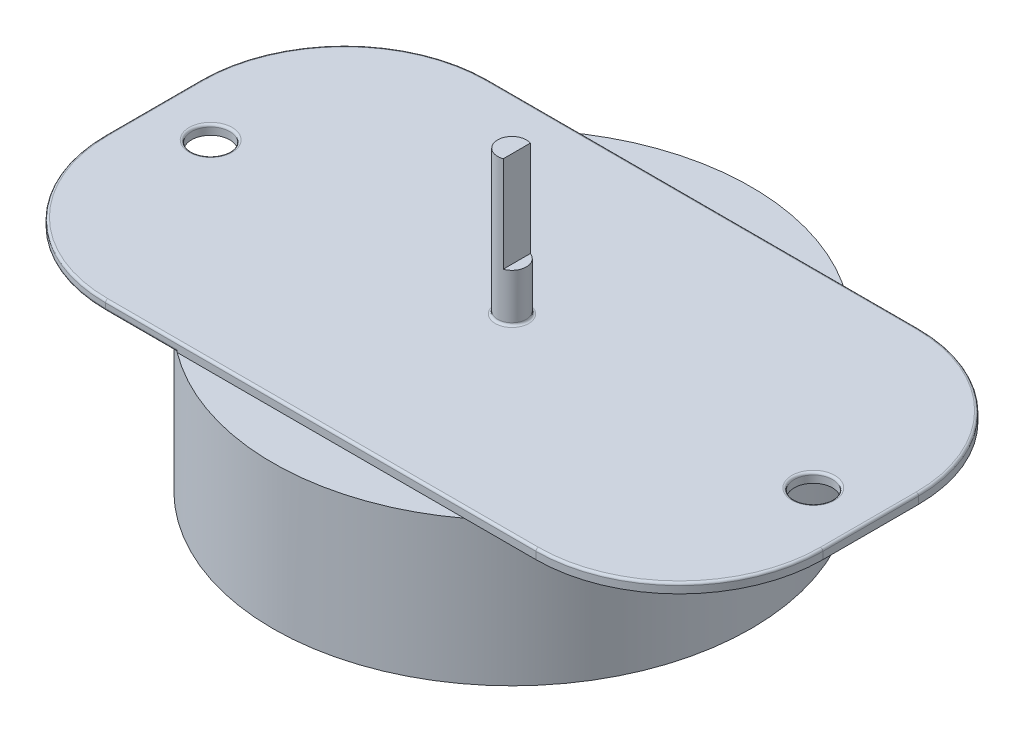
from build123d import *

# Parameters (mm, degrees)
ESBO_O1_R                = 50
RESSALTO_EXTRUS_O1_DEPTH = 30
RESSALTO_EXTRUS_O2_DEPTH = 2
ESBO_O3_R                = 3
RESSALTO_EXTRUS_O3_DEPTH = 30
ESBO_O4_W                = 2.913486889
ESBO_O4_H                = 6.765215319
CORTE_EXTRUS_O1_DEPTH    = 20
CORTE_EXTRUS_O2_REACH    = 97.65
ESBO_O6_R                = 4
FILETE2_R                = 0.5


with BuildPart() as part:
    # Esboço1 → Ressalto-extrusão1 (new body)
    with BuildSketch(Plane(origin=(0, 0, 0), x_dir=(1, 0, 0), z_dir=(0, 1, 0))):
        with Locations(Location((0, 0, 0), (0, 0, 270))):
            Circle(ESBO_O1_R)
    extrude(amount=RESSALTO_EXTRUS_O1_DEPTH)

    # Esboço2 → Ressalto-extrusão2 (add)
    with BuildSketch(Plane(origin=(0, 30, 0), x_dir=(1, 0, 0), z_dir=(0, 1, 0))):
        with BuildLine():
            Line((-45, -40), (45, -40))
            ThreePointArc((45, -40), (66.213203436, -31.213203436), (75, -10))
            Line((75, -10), (75, 10))
            ThreePointArc((75, 10), (66.213203436, 31.213203436), (45, 40))
            Line((45, 40), (-45, 40))
            ThreePointArc((-45, 40), (-66.213203436, 31.213203436), (-75, 10))
            Line((-75, 10), (-75, -10))
            ThreePointArc((-75, -10), (-66.213203436, -31.213203436), (-45, -40))
        make_face()
    extrude(amount=RESSALTO_EXTRUS_O2_DEPTH)

    # Esboço3 → Ressalto-extrusão3 (add)
    with BuildSketch(Plane(origin=(0, 32, 0), x_dir=(1, 0, 0), z_dir=(0, 1, 0))):
        with Locations(Location((0, 0, 0), (0, 0, 90))):
            Circle(ESBO_O3_R)
    extrude(amount=RESSALTO_EXTRUS_O3_DEPTH)

    # Esboço4 → Corte-extrusão1 (cut)
    with BuildSketch(Plane(origin=(0, 62, 0), x_dir=(1, 0, 0), z_dir=(0, 1, 0))):
        with Locations((2.456743444, -0.010763652)):
            Rectangle(ESBO_O4_W, ESBO_O4_H)
    extrude(amount=-CORTE_EXTRUS_O1_DEPTH, mode=Mode.SUBTRACT)

    # Esboço6 → Corte-extrusão2 (cut, up to next)
    with BuildSketch(Plane(origin=(0, 32, 0), x_dir=(1, 0, 0), z_dir=(0, 1, 0)), mode=Mode.PRIVATE) as corte_extrus_o2_sk1:
        with Locations(Location((-63, 0, 0), (0, 0, 270))):
            Circle(ESBO_O6_R)
    corte_extrus_o2_tool1 = extrude(corte_extrus_o2_sk1.sketch, amount=-CORTE_EXTRUS_O2_REACH, mode=Mode.PRIVATE) & part.part
    # Esboço6 → Corte-extrusão2 (cut, up to next)
    with BuildSketch(Plane(origin=(0, 32, 0), x_dir=(1, 0, 0), z_dir=(0, 1, 0)), mode=Mode.PRIVATE) as corte_extrus_o2_sk2:
        with Locations(Location((63, 0, 0), (0, 0, 90))):
            Circle(ESBO_O6_R)
    corte_extrus_o2_tool2 = extrude(corte_extrus_o2_sk2.sketch, amount=-CORTE_EXTRUS_O2_REACH, mode=Mode.PRIVATE) & part.part
    add(corte_extrus_o2_tool1.solids().sort_by_distance((-63, 32, 0))[0], mode=Mode.SUBTRACT)
    add(corte_extrus_o2_tool2.solids().sort_by_distance((63, 32, 0))[0], mode=Mode.SUBTRACT)

    # Filete2
    # the kernel refuses this fillet: 0.5 mm, written as the material it adds along each edge
    with BuildSketch(Plane(origin=(0, 32, 0), x_dir=(0, 0, -1), z_dir=(1, 0, 0))) as filete2_piece_1:
        with BuildLine():
            CenterArc((3 + FILETE2_R, FILETE2_R), FILETE2_R, 180, 90)
            Line((3, FILETE2_R), (3, 0))
            Line((3, 0), (3 + FILETE2_R, 0))
        make_face()
    revolve(axis=Axis((0, 32, 0), (0, 1, 0)))
    # the kernel refuses this fillet: 0.5 mm, written as the material it takes off along each edge
    with BuildSketch(Plane(origin=(-45, 30, 40), x_dir=(0, 0, -1), z_dir=(1, 0, 0))) as filete2_2_piece_1_section:
        with BuildLine():
            CenterArc((FILETE2_R, FILETE2_R), FILETE2_R, 180, 90)
            Line((0, FILETE2_R), (0, 0))
            Line((0, 0), (FILETE2_R, 0))
        make_face()
    filete2_2_piece_1 = extrude(amount=16.25, mode=Mode.PRIVATE)
    filete2_2_piece_1 = filete2_2_piece_1 - Plane(origin=(0, 30.083724815, 0), x_dir=(0, 0, 1), z_dir=(0, -1, 0)) * Cylinder(50, 35, mode=Mode.PRIVATE)
    add(filete2_2_piece_1, mode=Mode.SUBTRACT)
    with BuildSketch(Plane(origin=(45, 32, -10), x_dir=(1, 0, 0), z_dir=(0, 0, 1))) as filete2_2_piece_2:
        with BuildLine():
            CenterArc((30 - FILETE2_R, -FILETE2_R), FILETE2_R, 0, 90)
            Line((30 - FILETE2_R, 0), (30, 0))
            Line((30, 0), (30, -FILETE2_R))
        make_face()
    revolve(axis=Axis((45, 32, -10), (0, 1, 0)), revolution_arc=90, mode=Mode.SUBTRACT)
    with BuildSketch(Plane(origin=(45, 32, -40), x_dir=(0, -1, 0), z_dir=(-1, 0, 0)), Plane(origin=(-45, 32, 40), x_dir=(0, -1, 0), z_dir=(1, 0, 0))) as filete2_2_piece_3:
        with BuildLine():
            CenterArc((FILETE2_R, FILETE2_R), FILETE2_R, 180, 90)
            Line((0, FILETE2_R), (0, 0))
            Line((0, 0), (FILETE2_R, 0))
        make_face()
    extrude(amount=90, mode=Mode.SUBTRACT)
    with BuildSketch(Plane(origin=(-45, 32, -10), x_dir=(0, 0, -1), z_dir=(1, 0, 0))) as filete2_2_piece_4:
        with BuildLine():
            CenterArc((30 - FILETE2_R, -FILETE2_R), FILETE2_R, 0, 90)
            Line((30 - FILETE2_R, 0), (30, 0))
            Line((30, 0), (30, -FILETE2_R))
        make_face()
    revolve(axis=Axis((-45, 32, -10), (0, 1, 0)), revolution_arc=90, mode=Mode.SUBTRACT)
    with BuildSketch(Plane(origin=(-75, 32, -10), x_dir=(0, -1, 0), z_dir=(0, 0, 1)), Plane(origin=(75, 32, 10), x_dir=(0, -1, 0), z_dir=(0, 0, -1)), Plane(origin=(-75, 30, -10), x_dir=(1, 0, 0), z_dir=(0, 0, 1))) as filete2_2_piece_5:
        with BuildLine():
            CenterArc((FILETE2_R, FILETE2_R), FILETE2_R, 180, 90)
            Line((0, FILETE2_R), (0, 0))
            Line((0, 0), (FILETE2_R, 0))
        make_face()
    extrude(amount=20, mode=Mode.SUBTRACT)
    with BuildSketch(Plane(origin=(-45, 32, 10), x_dir=(-1, 0, 0), z_dir=(0, 0, -1))) as filete2_2_piece_6:
        with BuildLine():
            CenterArc((30 - FILETE2_R, -FILETE2_R), FILETE2_R, 0, 90)
            Line((30 - FILETE2_R, 0), (30, 0))
            Line((30, 0), (30, -FILETE2_R))
        make_face()
    revolve(axis=Axis((-45, 32, 10), (0, 1, 0)), revolution_arc=90, mode=Mode.SUBTRACT)
    with BuildSketch(Plane(origin=(45, 32, 10), x_dir=(0, 0, 1), z_dir=(-1, 0, 0))) as filete2_2_piece_7:
        with BuildLine():
            CenterArc((30 - FILETE2_R, -FILETE2_R), FILETE2_R, 0, 90)
            Line((30 - FILETE2_R, 0), (30, 0))
            Line((30, 0), (30, -FILETE2_R))
        make_face()
    revolve(axis=Axis((45, 32, 10), (0, 1, 0)), revolution_arc=90, mode=Mode.SUBTRACT)
    with BuildSketch(Plane(origin=(-63, 32, 0), x_dir=(0, 0, 1), z_dir=(-1, 0, 0))) as filete2_2_piece_8:
        with BuildLine():
            CenterArc((4 + FILETE2_R, -FILETE2_R), FILETE2_R, 90, 90)
            Line((4 + FILETE2_R, 0), (4, 0))
            Line((4, 0), (4, -FILETE2_R))
        make_face()
    revolve(axis=Axis((-63, 32, 0), (0, 1, 0)), mode=Mode.SUBTRACT)
    with BuildSketch(Plane(origin=(63, 32, 0), x_dir=(0, 0, -1), z_dir=(1, 0, 0))) as filete2_2_piece_9:
        with BuildLine():
            CenterArc((4 + FILETE2_R, -FILETE2_R), FILETE2_R, 90, 90)
            Line((4 + FILETE2_R, 0), (4, 0))
            Line((4, 0), (4, -FILETE2_R))
        make_face()
    revolve(axis=Axis((63, 32, 0), (0, 1, 0)), mode=Mode.SUBTRACT)
    with BuildSketch(Plane(origin=(-28.75, 30, -40), x_dir=(0, 0, 1), z_dir=(-1, 0, 0))) as filete2_2_piece_10_section:
        with BuildLine():
            CenterArc((FILETE2_R, FILETE2_R), FILETE2_R, 180, 90)
            Line((0, FILETE2_R), (0, 0))
            Line((0, 0), (FILETE2_R, 0))
        make_face()
    filete2_2_piece_10 = extrude(amount=16.25, mode=Mode.PRIVATE)
    filete2_2_piece_10 = filete2_2_piece_10 - Plane(origin=(0, 30.117437767, 0), x_dir=(0, 0, 1), z_dir=(0, -1, 0)) * Cylinder(50, 35, mode=Mode.PRIVATE)
    add(filete2_2_piece_10, mode=Mode.SUBTRACT)
    with BuildSketch(Plane(origin=(-45, 30, -10), x_dir=(0, 0, -1), z_dir=(1, 0, 0))) as filete2_2_piece_11:
        with BuildLine():
            CenterArc((30 - FILETE2_R, FILETE2_R), FILETE2_R, 270, 90)
            Line((30, FILETE2_R), (30, 0))
            Line((30, 0), (30 - FILETE2_R, 0))
        make_face()
    revolve(axis=Axis((-45, 30, -10), (0, 1, 0)), revolution_arc=90, mode=Mode.SUBTRACT)
    with BuildSketch(Plane(origin=(-45, 30, 10), x_dir=(-1, 0, 0), z_dir=(0, 0, -1))) as filete2_2_piece_12:
        with BuildLine():
            CenterArc((30 - FILETE2_R, FILETE2_R), FILETE2_R, 270, 90)
            Line((30, FILETE2_R), (30, 0))
            Line((30, 0), (30 - FILETE2_R, 0))
        make_face()
    revolve(axis=Axis((-45, 30, 10), (0, 1, 0)), revolution_arc=90, mode=Mode.SUBTRACT)


solid = part.part
